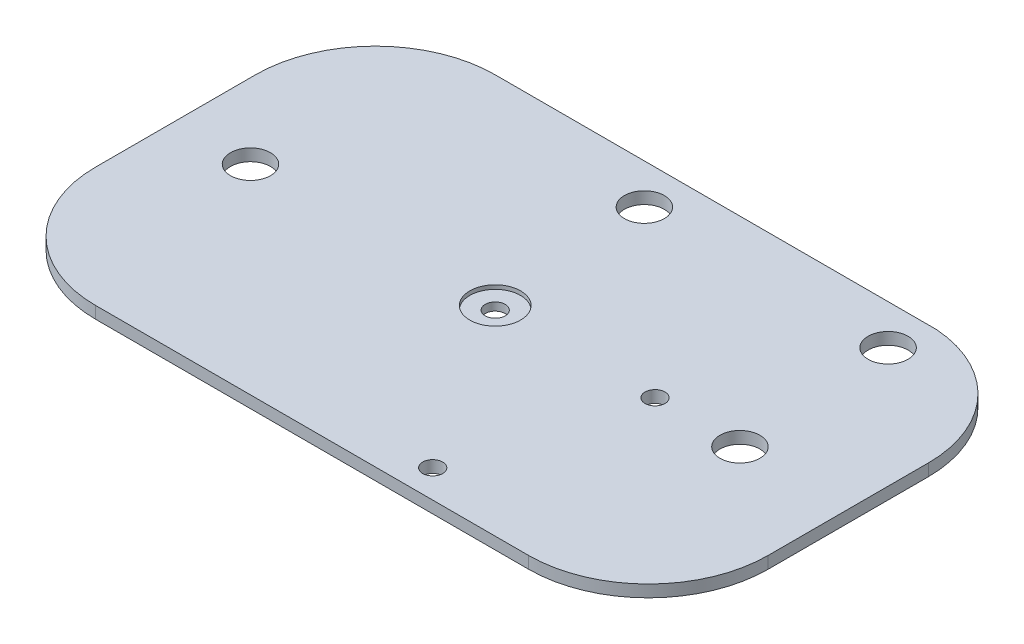
from build123d import *

# Parameters (mm, degrees)
EXTRUDE_1_DEPTH           = 50
EXTRUDE_1_DEPTH_BACK      = 50
SKETCH_2_W                = 200
SKETCH_2_H                = 100
EXTRUDE_2_DEPTH           = 40
SKETCH_3_W                = 200
SKETCH_3_H                = 34
CUT_EXTRUDE_1_DEPTH       = 100
CUT_EXTRUDE_2_DEPTH       = 279.66871012
SKETCH_8_R                = 2.5
CUT_EXTRUDE_4_DEPTH       = 276.238532913
SKETCH_10_R               = 5
CUT_EXTRUDE_5_DEPTH       = 260.608358879
EXTRUDE_5_DEPTH           = 10
SKETCH_13_W               = 74.115787845
SKETCH_13_H               = 3
EXTRUDE_7_DEPTH           = 81
SKETCH_14_W               = 207.5
SKETCH_14_H               = 100
EXTRUDE_8_DEPTH           = 7
EXTRUDE_9_DEPTH           = 10
SKETCH_17_R               = 6.35
CUT_EXTRUDE_6_DEPTH       = 1
CUT_EXTRUDE_START         = -1
SKETCH_18_R               = 6.35
CUT_EXTRUDE_7_DEPTH       = 1
SKETCH_20_R               = 5
CUT_EXTRUDE_8_DEPTH       = 3
CUT_EXTRUDE_9_DEPTH       = 273.255129638
CUT_EXTRUDE_9_DEPTH_BACK  = 273.255129638
SKETCH_21_W               = 31.665374736
SKETCH_21_H               = 100
SKETCH_22_R               = 5
EXTRUDE_10_DEPTH          = 37
FILLET_1_R                = 30
FILLET_2_R                = 30
CUT_EXTRUDE_10_DEPTH      = 248.444254611
CUT_EXTRUDE_10_DEPTH_BACK = 248.444254611
CUT_EXTRUDE_11_DEPTH      = 211.689689342
CUT_EXTRUDE_11_DEPTH_BACK = 211.689689342
CUT_EXTRUDE_12_DEPTH      = 174.368632309
CUT_EXTRUDE_12_DEPTH_BACK = 174.368632309
SKETCH_26_R               = 5
CUT_EXTRUDE_13_DEPTH      = 153.295269567
CUT_EXTRUDE_13_DEPTH_BACK = 153.295269567
CUT_EXTRUDE_14_DEPTH      = 160.286168691
CUT_EXTRUDE_14_DEPTH_BACK = 160.286168691
SKETCH_30_R               = 7.5
CUT_EXTRUDE_15_DEPTH      = 160.286168691
CUT_EXTRUDE_15_DEPTH_BACK = 160.286168691
SKETCH_31_R               = 7.5
SKETCH_32_R               = 7.5
SKETCH_32_R_2             = 5
EXTRUDE_12_DEPTH          = 3
SKETCH_33_R               = 7.5
SKETCH_33_R_2             = 5
EXTRUDE_13_DEPTH          = 3
SKETCH_34_R               = 5
EXTRUDE_14_DEPTH          = 45
CUT_EXTRUDE_19_DEPTH      = 178.031776809
CUT_EXTRUDE_19_DEPTH_BACK = 178.031776809
SKETCH_41_W               = 127.955451874
SKETCH_41_H               = 44.187888027
CUT_EXTRUDE_20_DEPTH      = 173.639074372
CUT_EXTRUDE_20_DEPTH_BACK = 173.639074372
SKETCH_42_W               = 60.696300107
SKETCH_42_H               = 16.694862056
SKETCH_44_R               = 2.5
CUT_EXTRUDE_21_DEPTH      = 10


with BuildPart() as part:
    # 草图1 → 凸台-拉伸1 (new, two sides: drawn at the far end of the back side and taken through both)
    with BuildSketch(Plane(origin=(0, 0, 0), x_dir=(1, 0, 0), z_dir=(0, 1, 0)).offset(-EXTRUDE_1_DEPTH_BACK)):
        Polygon((9.5, 12.5), (9.5, 0), (90.5, 0), (90.5, 12.5), (90.5, 212.5), (9.5, 212.5), align=None)
    extrude(amount=EXTRUDE_1_DEPTH + EXTRUDE_1_DEPTH_BACK)

    # 草图2 → 凸台-拉伸2 (add)
    with BuildSketch(Plane(origin=(0, 0, 0), x_dir=(-1, 0, 0), z_dir=(0, -1, 0))):
        with Locations((-50, -50)):
            Rectangle(SKETCH_2_W, SKETCH_2_H)
    extrude(amount=-EXTRUDE_2_DEPTH)

    # 草图3 → 切除-拉伸1 (cut)
    with BuildSketch(Plane.XY.offset(100)):
        with Locations((50, 20)):
            Rectangle(SKETCH_3_W, SKETCH_3_H)
    extrude(amount=-CUT_EXTRUDE_1_DEPTH, mode=Mode.SUBTRACT)

    # 草图6 → 切除-拉伸2 (cut, through all)
    with BuildSketch(Plane(origin=(0, 50, 0), x_dir=(1, 0, 0), z_dir=(0, 1, 0))):
        Polygon((12.5, 905.325014188), (12.5, 212.5), (12.5, 5), (87.5, 5), (87.5, 212.5), (87.5, 905.325014188), (87.5, 2290.975042562), (12.5, 2290.975042562), align=None)
    extrude(amount=-CUT_EXTRUDE_2_DEPTH, mode=Mode.SUBTRACT)

    # 草图8 → 切除-拉伸4 (cut, through all)
    with BuildSketch(Plane(origin=(0, 40, 0), x_dir=(1, 0, 0), z_dir=(0, 1, 0))):
        with Locations(Location((70, -50, 0), (0, 0, 270))):
            Circle(SKETCH_8_R)
        with Locations(Location((30, -50, 0), (0, 0, 270))):
            Circle(SKETCH_8_R)
    extrude(amount=-CUT_EXTRUDE_4_DEPTH, mode=Mode.SUBTRACT)

    # 草图10 → 切除-拉伸5 (cut, through all)
    with BuildSketch(Plane(origin=(90.5, 0, 0), x_dir=(0, 0, -1), z_dir=(1, 0, 0))):
        with Locations((80, 0)):
            Circle(SKETCH_10_R)
        with Locations((180, 0)):
            Circle(SKETCH_10_R)
    extrude(amount=-CUT_EXTRUDE_5_DEPTH, mode=Mode.SUBTRACT)

    # 草图11 → 凸台-拉伸5 (add)
    with BuildSketch(Plane.ZY.offset(-9.5)):
        Polygon((-30.905613639, 83.415207604), (-74.094429483, 50), (0, 50), (0, 40), (83.32101017, 40), align=None)
    extrude(amount=-EXTRUDE_5_DEPTH)

    # 草图13 → 凸台-拉伸7 (add)
    with BuildSketch(Plane(origin=(90.5, 0, 0), x_dir=(0, 0, -1), z_dir=(1, 0, 0))):
        with Locations((37.057893922, 51.5)):
            Rectangle(SKETCH_13_W, SKETCH_13_H)
    extrude(amount=-EXTRUDE_7_DEPTH)

    # 草图14 → 凸台-拉伸8 (add)
    with BuildSketch(Plane(origin=(12.5, 0, 0), x_dir=(0, 0, -1), z_dir=(1, 0, 0))):
        with Locations((108.75, 0)):
            Rectangle(SKETCH_14_W, SKETCH_14_H)
    extrude(amount=EXTRUDE_8_DEPTH)

    # 草图15 → 凸台-拉伸9 (add)
    with BuildSketch(Plane(origin=(90.5, 0, 0), x_dir=(0, 0, -1), z_dir=(1, 0, 0))):
        Polygon((30.905613639, 83.415207604), (-82.902171575, 40), (0, 40), (0, 53), (70.216960007, 53), align=None)
    extrude(amount=-EXTRUDE_9_DEPTH)

    # 草图17 → 切除-拉伸6 (cut)
    with BuildSketch(Plane(origin=(0, 37, 0), x_dir=(-1, 0, 0), z_dir=(0, -1, 0))):
        with Locations(Location((-30, -50, 0), (0, 0, 90))):
            Circle(SKETCH_17_R)
    extrude(amount=-CUT_EXTRUDE_6_DEPTH, mode=Mode.SUBTRACT)

    # 草图18 → 切除-拉伸7 (cut)
    with BuildSketch(Plane(origin=(0, 3, 0), x_dir=(1, 0, 0), z_dir=(0, 1, 0)).offset(CUT_EXTRUDE_START)):
        with Locations(Location((30, -50, 0), (0, 0, 90))):
            Circle(SKETCH_18_R)
    extrude(amount=CUT_EXTRUDE_7_DEPTH, mode=Mode.SUBTRACT)

    # 草图20 → 切除-拉伸8 (cut)
    with BuildSketch(Plane.XZ):
        with Locations(Location((-31.25, 50, 0), (0, 0, 270))):
            Circle(SKETCH_20_R)
        with Locations(Location((91.25, 50, 0), (0, 0, 270))):
            Circle(SKETCH_20_R)
    extrude(amount=-CUT_EXTRUDE_8_DEPTH, mode=Mode.SUBTRACT)

    # 草图21 → 切除-拉伸9 (cut, two sides: drawn at the far end of the back side and taken through both)
    with BuildSketch(Plane(origin=(0, 3, 0), x_dir=(1, 0, 0), z_dir=(0, 1, 0)).offset(-CUT_EXTRUDE_9_DEPTH_BACK)):
        with Locations((134.167312632, -50)):
            Rectangle(SKETCH_21_W, SKETCH_21_H)
    extrude(amount=CUT_EXTRUDE_9_DEPTH + CUT_EXTRUDE_9_DEPTH_BACK, mode=Mode.SUBTRACT)

    # 草图22 → 凸台-拉伸10 (add)
    with BuildSketch(Plane.XZ):
        with Locations((-28.834995313, 14.93844285)):
            Circle(SKETCH_22_R)
        with Locations((99.943738589, 14.93844285)):
            Circle(SKETCH_22_R)
        with Locations((47.358621855, 88.902784002)):
            Circle(SKETCH_22_R)
    extrude(amount=-EXTRUDE_10_DEPTH)

    # 圆角1
    # the kernel refuses this fillet: 30 mm, written as the material it takes off along each edge
    with BuildSketch(Plane(origin=(-32.536340759, 83.415207604, -30.905613639), x_dir=(0, -0.6119293356637439, -0.7909124402575352), z_dir=(1, 0, 0))) as fillet_1_piece_1:
        with BuildLine():
            CenterArc((FILLET_1_R * 0.560484543454, -FILLET_1_R), FILLET_1_R, 90, 58.539912966)
            Line((-FILLET_1_R * 0.292519393108, -FILLET_1_R * 0.478095521948), (-FILLET_1_R * 0.309579471839, -FILLET_1_R * 0.467657432387))
            Line((-FILLET_1_R * 0.309579471839, -FILLET_1_R * 0.467657432387), (-FILLET_1_R * 0.0112096908691, FILLET_1_R * 0.02))
            Line((-FILLET_1_R * 0.0112096908691, FILLET_1_R * 0.02), (FILLET_1_R * 0.560484543454, FILLET_1_R * 0.02))
            Line((FILLET_1_R * 0.560484543454, FILLET_1_R * 0.02), (FILLET_1_R * 0.560484543454, 0))
        make_face()
    extrude(amount=94.072681518, mode=Mode.SUBTRACT)
    with BuildSketch(Plane(origin=(132.596564701, 83.415207604, -30.905613639), x_dir=(0, -0.6119293356637436, -0.7909124402575354), z_dir=(-1, 0, 0))) as fillet_1_piece_2:
        with BuildLine():
            CenterArc((FILLET_1_R * 0.561287529341, FILLET_1_R), FILLET_1_R, 211.390091687, 58.609908313)
            Line((-FILLET_1_R * 0.292353354769, FILLET_1_R * 0.479137982787), (-FILLET_1_R * 0.309426172451, FILLET_1_R * 0.468720742443))
            Line((-FILLET_1_R * 0.309426172451, FILLET_1_R * 0.468720742443), (-FILLET_1_R * 0.0112257505868, -FILLET_1_R * 0.02))
            Line((-FILLET_1_R * 0.0112257505868, -FILLET_1_R * 0.02), (FILLET_1_R * 0.561287529341, -FILLET_1_R * 0.02))
            Line((FILLET_1_R * 0.561287529341, -FILLET_1_R * 0.02), (FILLET_1_R * 0.561287529341, 0))
        make_face()
    extrude(amount=94.193129401, mode=Mode.SUBTRACT)
    with BuildSketch(Plane(origin=(118.334625264, -38, 100), x_dir=(-1, 0, 0), z_dir=(0, 1, 0)), Plane(origin=(118.334625264, -75, 100), x_dir=(-1, 0, 0), z_dir=(0, 1, 0)), Plane(origin=(-50, -38, 0), x_dir=(1, 0, 0), z_dir=(0, 1, 0)), Plane(origin=(-50, -38, 100), x_dir=(0, 0, -1), z_dir=(0, 1, 0)), Plane(origin=(-50, -75, 100), x_dir=(0, 0, -1), z_dir=(0, 1, 0)), Plane(origin=(-50, -75, 0), x_dir=(1, 0, 0), z_dir=(0, 1, 0))) as fillet_1_piece_3:
        with BuildLine():
            CenterArc((FILLET_1_R, -FILLET_1_R), FILLET_1_R, 90, 90)
            Line((0, -FILLET_1_R), (-FILLET_1_R * 0.02, -FILLET_1_R))
            Line((-FILLET_1_R * 0.02, -FILLET_1_R), (-FILLET_1_R * 0.02, FILLET_1_R * 0.02))
            Line((-FILLET_1_R * 0.02, FILLET_1_R * 0.02), (FILLET_1_R, FILLET_1_R * 0.02))
            Line((FILLET_1_R, FILLET_1_R * 0.02), (FILLET_1_R, 0))
        make_face()
    extrude(amount=153, mode=Mode.SUBTRACT)
    with BuildSketch(Plane(origin=(118.334625264, 114.804376219, 0), x_dir=(0, 0, 1), z_dir=(0, -1, 0))) as fillet_1_piece_4:
        with BuildLine():
            CenterArc((29.921750488, 30), FILLET_1_R, 184.139160489, 85.860839511)
            Line((0, 27.834625264), (-0.59843501, 27.791317769))
            ThreePointArc((-0.59843501, 27.791317769), (-0.6, 13.917312632), (-0.6, 0))
            Line((-0.6, 0), (0, -0.6))
            Line((0, -0.6), (29.921750488, -0.6))
            Line((29.921750488, -0.6), (29.921750488, 0))
        make_face()
    extrude(amount=152.608752439, mode=Mode.SUBTRACT)
    with BuildSketch(Plane(origin=(118.334625264, 77.804376219, 0), x_dir=(-1, 0, 0), z_dir=(0, -1, 0))) as fillet_1_piece_5:
        with BuildLine():
            CenterArc((30, -29.921750488), FILLET_1_R, 94.139160489, 85.860839511)
            Line((0, -29.921750488), (-0.6, -29.921750488))
            Line((-0.6, -29.921750488), (-0.6, 0))
            Line((-0.6, 0), (0, 0.6))
            ThreePointArc((0, 0.6), (13.917312632, 0.6), (27.791317769, 0.59843501))
            Line((27.791317769, 0.59843501), (27.834625264, 0))
        make_face()
    extrude(amount=152.608752439, mode=Mode.SUBTRACT)

    # 圆角2
    fillet_2_edges = [part.edges().sort_by_distance(p)[0] for p in [
        (89, 50, -212.5),
        (89, -50, -212.5),
        (14.5, 50, -212.5),
        (14.5, -50, -212.5),
    ]]
    fillet(fillet_2_edges, radius=FILLET_2_R)

    # 草图23 → 切除-拉伸10 (cut, two sides: drawn at the far end of the back side and taken through both)
    with BuildSketch(Plane(origin=(19.5, 0, 0), x_dir=(0, 0, -1), z_dir=(1, 0, 0)).offset(-CUT_EXTRUDE_10_DEPTH_BACK)):
        Polygon((-82.902171575, 40), (15.172878857, 77.413509693), (30.26062931, 83.169160038), (82.911746167, 53.484816406), (216.982404769, 51.400816531), (216.982404769, -53.030732743), (0, -55.346288159), (0, 40), align=None)
    extrude(amount=CUT_EXTRUDE_10_DEPTH + CUT_EXTRUDE_10_DEPTH_BACK, mode=Mode.SUBTRACT)

    # 草图25 → 切除-拉伸11 (cut, two sides: drawn at the far end of the back side and taken through both)
    with BuildSketch(Plane(origin=(118.334625264, 0, 0), x_dir=(0, 0, -1), z_dir=(1, 0, 0)).offset(-CUT_EXTRUDE_11_DEPTH_BACK)):
        Polygon((-96.999238457, 37), (-5.714105567, 37), (-5.714105567, 3), (-98.622428797, 3), align=None)
    extrude(amount=CUT_EXTRUDE_11_DEPTH + CUT_EXTRUDE_11_DEPTH_BACK, mode=Mode.SUBTRACT)


with BuildPart() as cut_extrude_11_piece_1:
    # of the separate pieces the step leaves, piece 1, a body of its own (cut_extrude_11_pieces)
    add(part.part.solids().sort_by_distance((118.334625264, 37, 70))[0])


with BuildPart() as cut_extrude_11_piece_2:
    # of the separate pieces the step leaves, piece 2, a body of its own (cut_extrude_11_pieces)
    add(part.part.solids().sort_by_distance((-20, 0, 0))[0])


with BuildPart() as cut_extrude_12_tool:
    # 草图26 → 切除-拉伸12 (new, two sides: drawn at the far end of the back side and taken through both)
    with BuildSketch(Plane.XZ.offset(-CUT_EXTRUDE_12_DEPTH_BACK)):
        with Locations(Location((88.334625264, 10, 0), (0, 0, 270))):
            Circle(SKETCH_26_R)
        with Locations(Location((27.334625264, 10, 0), (0, 0, 270))):
            Circle(SKETCH_26_R)
    extrude(amount=CUT_EXTRUDE_12_DEPTH + CUT_EXTRUDE_12_DEPTH_BACK)


with BuildPart() as cut_extrude_11_piece_1_1:
    add(cut_extrude_11_piece_1.part)

    # 切除-拉伸12: cut by cut_extrude_12_tool
    add(cut_extrude_12_tool.part, mode=Mode.SUBTRACT)

    # 草图27 → 切除-拉伸13 (cut, two sides: drawn at the far end of the back side and taken through both)
    with BuildSketch(Plane.ZY.offset(-34.5).offset(-CUT_EXTRUDE_13_DEPTH_BACK)):
        Polygon((-18.94184398, 81.696068066), (-17.663883038, 66.307288383), (80.739109538, 40), (87.341907742, 40), align=None)
    extrude(amount=CUT_EXTRUDE_13_DEPTH + CUT_EXTRUDE_13_DEPTH_BACK, mode=Mode.SUBTRACT)


with BuildPart() as cut_extrude_11_piece_2_1:
    add(cut_extrude_11_piece_2.part)

    # 切除-拉伸12: cut by cut_extrude_12_tool
    add(cut_extrude_12_tool.part, mode=Mode.SUBTRACT)


with BuildPart() as cut_extrude_14_tool:
    # 草图30 → 切除-拉伸14 (new, two sides: drawn at the far end of the back side and taken through both)
    with BuildSketch(Plane.XZ.offset(-37).offset(-CUT_EXTRUDE_14_DEPTH_BACK)):
        with Locations(Location((88.334625264, 10, 0), (0, 0, 270))):
            Circle(SKETCH_30_R)
    extrude(amount=CUT_EXTRUDE_14_DEPTH + CUT_EXTRUDE_14_DEPTH_BACK)


with BuildPart() as cut_extrude_11_piece_1_2:
    add(cut_extrude_11_piece_1_1.part)

    # 切除-拉伸14: cut by cut_extrude_14_tool
    add(cut_extrude_14_tool.part, mode=Mode.SUBTRACT)


with BuildPart() as cut_extrude_11_piece_2_2:
    add(cut_extrude_11_piece_2_1.part)

    # 切除-拉伸14: cut by cut_extrude_14_tool
    add(cut_extrude_14_tool.part, mode=Mode.SUBTRACT)


with BuildPart() as cut_extrude_15_tool:
    # 草图31 → 切除-拉伸15 (new, two sides: drawn at the far end of the back side and taken through both)
    with BuildSketch(Plane.XZ.offset(-37).offset(-CUT_EXTRUDE_15_DEPTH_BACK)):
        with Locations(Location((27.334625264, 10, 0), (0, 0, 270))):
            Circle(SKETCH_31_R)
    extrude(amount=CUT_EXTRUDE_15_DEPTH + CUT_EXTRUDE_15_DEPTH_BACK)


with BuildPart() as cut_extrude_11_piece_1_3:
    add(cut_extrude_11_piece_1_2.part)

    # 切除-拉伸15: cut by cut_extrude_15_tool
    add(cut_extrude_15_tool.part, mode=Mode.SUBTRACT)



with BuildPart() as cut_extrude_11_piece_2_3:
    add(cut_extrude_11_piece_2_2.part)

    # 切除-拉伸15: cut by cut_extrude_15_tool
    add(cut_extrude_15_tool.part, mode=Mode.SUBTRACT)

    # 草图32 → 凸台-拉伸12 (add)
    with BuildSketch(Plane.XZ):
        with Locations(Location((27.334625264, 10, 0), (0, 0, 270))):
            Circle(SKETCH_32_R)
        with Locations(Location((27.334625264, 10, 0), (0, 0, 270))):
            Circle(SKETCH_32_R_2, mode=Mode.SUBTRACT)
    extrude(amount=-EXTRUDE_12_DEPTH)

    # 草图33 → 凸台-拉伸13 (add)
    with BuildSketch(Plane.XZ):
        with Locations(Location((88.334625264, 10, 0), (0, 0, 270))):
            Circle(SKETCH_33_R)
        with Locations(Location((88.334625264, 10, 0), (0, 0, 270))):
            Circle(SKETCH_33_R_2, mode=Mode.SUBTRACT)
    extrude(amount=-EXTRUDE_13_DEPTH)


with BuildPart() as cut_extrude_11_piece_1_4:
    add(cut_extrude_11_piece_1_3.part)

    add(cut_extrude_11_piece_2_3.part)  # 凸台-拉伸14 merges 切除-拉伸11 piece 2
    # 草图34 → 凸台-拉伸14 (add)
    with BuildSketch(Plane.XZ.offset(-37)):
        with Locations(Location((57.356592352, 86.553493229, 0), (0, 0, 90))):
            Circle(SKETCH_34_R)
    extrude(amount=EXTRUDE_14_DEPTH)

    # 草图41 → 切除-拉伸19 (cut, two sides: drawn at the far end of the back side and taken through both)
    with BuildSketch(Plane(origin=(90.5, 0, 0), x_dir=(0, 0, -1), z_dir=(1, 0, 0)).offset(-CUT_EXTRUDE_19_DEPTH_BACK)):
        with Locations((-46.591902261, 25.093944013)):
            Rectangle(SKETCH_41_W, SKETCH_41_H)
    extrude(amount=CUT_EXTRUDE_19_DEPTH + CUT_EXTRUDE_19_DEPTH_BACK, mode=Mode.SUBTRACT)

    # 草图42 → 切除-拉伸20 (cut, two sides: drawn at the far end of the back side and taken through both)
    with BuildSketch(Plane(origin=(90.5, 0, 0), x_dir=(0, 0, -1), z_dir=(1, 0, 0)).offset(-CUT_EXTRUDE_20_DEPTH_BACK)):
        with Locations((-72.283598444, -8.347431028)):
            Rectangle(SKETCH_42_W, SKETCH_42_H)
    extrude(amount=CUT_EXTRUDE_20_DEPTH + CUT_EXTRUDE_20_DEPTH_BACK, mode=Mode.SUBTRACT)

    # 草图44 → 切除-拉伸21 (cut)
    with BuildSketch(Plane.XZ):
        with Locations(Location((57.356592352, 93, 0), (0, 0, 270))):
            Circle(SKETCH_44_R)
    extrude(amount=-CUT_EXTRUDE_21_DEPTH, mode=Mode.SUBTRACT)


solid = cut_extrude_11_piece_1_4.part
